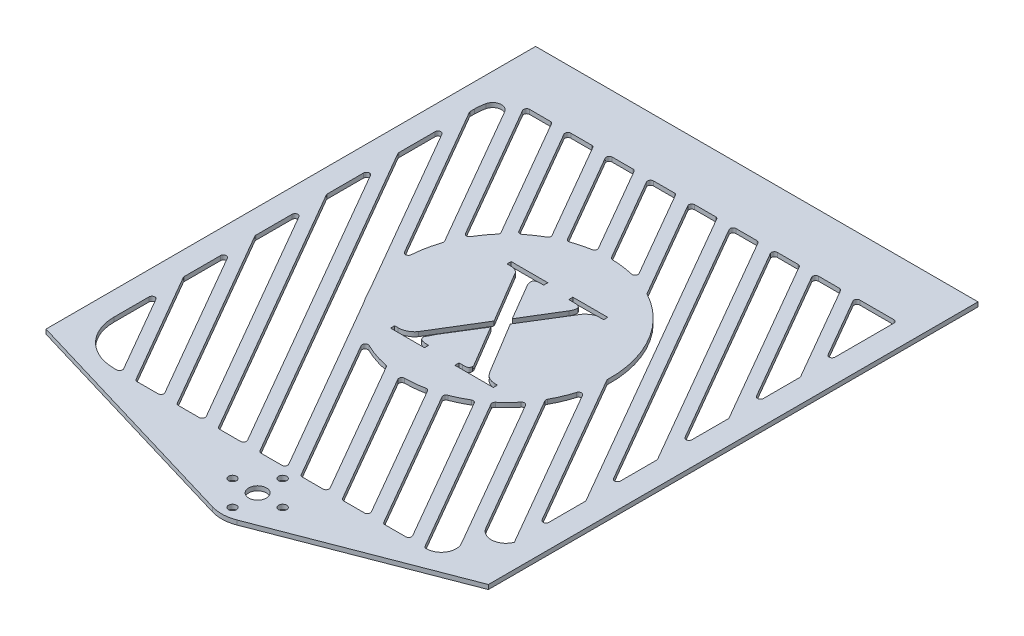
from build123d import *

# Parameters (mm, degrees)
SKETCH_1_R          = 12.25
SKETCH_1_R_2        = 1.35
SKETCH_1_R_3        = 3
EXTRUDE_1_DEPTH     = 1.5
EXTRUDE_START       = -1.5
EXTRUDE_2_DEPTH     = 1.5
CUT_EXTRUDE_2_DEPTH = 188.165201093
CUT_EXTRUDE_3_DEPTH = 10
FILLET_3_R          = 15
FILLET_4_R          = 3
FILLET_5_R          = 5
SKETCH_6_W          = 150
SKETCH_6_H          = 11
EXTRUDE_3_DEPTH     = 1.5
FILLET_6_R          = 1


with BuildPart() as part:
    # 草图1 → 凸台-拉伸1 (new body)
    with BuildSketch(Plane(origin=(0, 0, 0), x_dir=(1, 0, 0), z_dir=(0, 1, 0))):
        with Locations(Location((0, 0, 0), (0, 0, 270))):
            Circle(SKETCH_1_R)
        with Locations(Location((0, 8.5, 0), (0, 0, 270))):
            Circle(SKETCH_1_R_2, mode=Mode.SUBTRACT)
        with Locations(Location((8.5, 0, 0), (0, 0, 270))):
            Circle(SKETCH_1_R_2, mode=Mode.SUBTRACT)
        with Locations(Location((0, -8.5, 0), (0, 0, 270))):
            Circle(SKETCH_1_R_2, mode=Mode.SUBTRACT)
        with Locations(Location((-8.5, 0, 0), (0, 0, 270))):
            Circle(SKETCH_1_R_2, mode=Mode.SUBTRACT)
        with Locations(Location((0, 0, 0), (0, 0, 270))):
            Circle(SKETCH_1_R_3, mode=Mode.SUBTRACT)
    extrude(amount=EXTRUDE_1_DEPTH)

    # 草图2 → 凸台-拉伸2 (add)
    with BuildSketch(Plane(origin=(0, 1.5, 0), x_dir=(1, 0, 0), z_dir=(0, 1, 0)).offset(EXTRUDE_START)):
        with BuildLine():
            Line((-84, 12.25), (-3.498512537, -11.739800255))
            ThreePointArc((-3.498512537, -11.739800255), (-0.474020435, 12.240825325), (4.395911064, -11.434092265))
            Line((4.395911064, -11.434092265), (66, 12.25))
            Line((66, 12.25), (66, 167.25))
            Line((66, 167.25), (-84, 167.25))
            Line((-84, 167.25), (-84, 12.25))
        make_face()
    extrude(amount=EXTRUDE_2_DEPTH)

    # 草图4 → 切除-拉伸2 (cut, through all)
    with BuildSketch(Plane(origin=(0, 1.5, 0), x_dir=(1, 0, 0), z_dir=(0, 1, 0))):
        with BuildLine():
            Line((-6.774095733, 92.456140351), (3.8388564, 74.912280702))
            add(Edge.make_bspline(
                [(3.8388564, 74.912280702), (3.990709067, 74.692636132), (4.2799757, 74.274231591), (4.761505175, 73.718644294), (5.262896761, 73.264665473), (5.789882123, 72.907665947), (6.342654511, 72.661359883), (6.90483624, 72.474337914), (7.487133075, 72.356744918), (7.884234413, 72.345060393), (8.084037254, 72.339181287)],
                knots=[0, 0, 0, 0, 1.231960927, 2.346782558, 3.385184183, 4.346451651, 5.270969098, 6.168867011, 7.078659433, 8, 8, 8, 8], degree=3))
            Line((8.084037254, 72.339181287), (8.993718865, 72.339181287))
            Line((8.993718865, 72.339181287), (8.993718865, 70.935672515))
            Line((8.993718865, 70.935672515), (-4.045050899, 70.935672515))
            Line((-4.045050899, 70.935672515), (-4.045050899, 72.339181287))
            Line((-4.045050899, 72.339181287), (-2.832142084, 72.339181287))
            add(Edge.make_bspline(
                [(-2.832142084, 72.339181287), (-2.603856116, 72.344829862), (-2.198269681, 72.354865456), (-1.662002639, 72.406056705), (-1.271320107, 72.505072734), (-0.949736715, 72.703294184), (-0.758262133, 73.064186857), (-0.725859892, 73.359925143), (-0.709551657, 73.50877193)],
                knots=[0, 0, 0, 0, 1.480939666, 2.631125546, 3.490581069, 4.072498027, 5.029877129, 6, 6, 6, 6], degree=3))
            add(Edge.make_bspline(
                [(-0.709551657, 73.50877193), (-0.725375877, 73.667939704), (-0.758524054, 74.001360346), (-0.925508935, 74.29236112), (-1.012778861, 74.444444444)],
                knots=[0, 0, 0, 0, 0.954756568, 2, 2, 2, 2], degree=3))
            Line((-1.012778861, 74.444444444), (-9.199913364, 88.245614035))
            Line((-9.199913364, 88.245614035), (-16.174139051, 77.01754386))
            add(Edge.make_bspline(
                [(-16.174139051, 77.01754386), (-16.270268942, 76.833140892), (-16.451179764, 76.486105312), (-16.694852575, 75.988387373), (-16.90195827, 75.548980822), (-17.026381927, 75.273411982), (-17.083820663, 75.14619883)],
                knots=[0, 0, 0, 0, 1.199066972, 2.256573778, 3.195167548, 4, 4, 4, 4], degree=3))
            add(Edge.make_bspline(
                [(-17.083820663, 75.14619883), (-17.17718498, 75.006686055), (-17.34187262, 74.760596001), (-17.5101519, 74.414882452), (-17.658456751, 74.178255463), (-17.681466712, 74.032430793), (-17.69027507, 73.976608187)],
                knots=[0, 0, 0, 0, 1.515902277, 2.673937721, 3.492374973, 4, 4, 4, 4], degree=3))
            add(Edge.make_bspline(
                [(-17.69027507, 73.976608187), (-17.68521353, 73.830447657), (-17.67568119, 73.555185258), (-17.517112577, 73.183168295), (-17.27378702, 72.881322575), (-16.931417896, 72.663845089), (-16.515116327, 72.529204475), (-16.049944951, 72.411264663), (-15.522635664, 72.357502805), (-15.154772007, 72.34549754), (-14.961230236, 72.339181287)],
                knots=[0, 0, 0, 0, 0.966903205, 1.820957383, 2.641401959, 3.516652834, 4.478372564, 5.547131829, 6.709488039, 8, 8, 8, 8], degree=3))
            Line((-14.961230236, 72.339181287), (-14.354775828, 72.339181287))
            Line((-14.354775828, 72.339181287), (-14.354775828, 70.935672515))
            Line((-14.354775828, 70.935672515), (-25.877409573, 70.935672515))
            Line((-25.877409573, 70.935672515), (-25.877409573, 72.339181287))
            Line((-25.877409573, 72.339181287), (-24.664500758, 72.339181287))
            add(Edge.make_bspline(
                [(-24.664500758, 72.339181287), (-24.418495397, 72.347385612), (-23.934487, 72.363527383), (-23.224910427, 72.49503351), (-22.556778473, 72.722794414), (-21.933893095, 73.027301415), (-21.367957342, 73.386301289), (-20.872972794, 73.786238391), (-20.44778626, 74.209382937), (-20.224656855, 74.524864333), (-20.116092701, 74.678362573)],
                knots=[0, 0, 0, 0, 1.109548882, 2.18300517, 3.242048789, 4.285260785, 5.30468078, 6.259150818, 7.152985601, 8, 8, 8, 8], degree=3))
            Line((-20.116092701, 74.678362573), (-10.412822179, 90.584795322))
            Line((-10.412822179, 90.584795322), (-20.722547109, 107.894736842))
            add(Edge.make_bspline(
                [(-20.722547109, 107.894736842), (-20.77939181, 108.00964542), (-20.892965203, 108.239228068), (-21.135987472, 108.548201186), (-21.434847425, 108.826914427), (-21.789062971, 109.076891364), (-22.197896668, 109.28807621), (-22.666402554, 109.434438317), (-23.191311946, 109.521154138), (-23.560971971, 109.528376425), (-23.754819147, 109.532163743)],
                knots=[0, 0, 0, 0, 0.84023109, 1.678747421, 2.564428756, 3.517053343, 4.518117347, 5.573937512, 6.727789513, 8, 8, 8, 8], degree=3))
            Line((-23.754819147, 109.532163743), (-24.967727962, 109.532163743))
            Line((-24.967727962, 109.532163743), (-24.967727962, 110.935672515))
            Line((-24.967727962, 110.935672515), (-12.535412606, 110.935672515))
            Line((-12.535412606, 110.935672515), (-12.535412606, 109.532163743))
            Line((-12.535412606, 109.532163743), (-13.445094217, 109.532163743))
            add(Edge.make_bspline(
                [(-13.445094217, 109.532163743), (-13.717300174, 109.525936846), (-14.202180301, 109.514844884), (-14.84307913, 109.395101946), (-15.31684967, 109.184696443), (-15.602281243, 108.837446935), (-15.681965309, 108.409019919), (-15.658969536, 107.915937259), (-15.506826395, 107.343088607), (-15.34984432, 106.942848067), (-15.26445744, 106.725146199)],
                knots=[0, 0, 0, 0, 1.445461397, 2.574798561, 3.453827859, 4.142091928, 4.868361955, 5.713474923, 6.756295948, 8, 8, 8, 8], degree=3))
            Line((-15.26445744, 106.725146199), (-7.987004548, 94.32748538))
            Line((-7.987004548, 94.32748538), (-0.709551657, 106.257309942))
            add(Edge.make_bspline(
                [(-0.709551657, 106.257309942), (-0.575412858, 106.511089371), (-0.332749203, 106.970188784), (-0.096229746, 107.64047753), (0.001295172, 108.214072564), (-0.067445253, 108.710438663), (-0.3350494, 109.122397951), (-0.825432283, 109.360715977), (-1.464912059, 109.513194536), (-1.952805528, 109.525359689), (-2.225687676, 109.532163743)],
                knots=[0, 0, 0, 0, 1.377633241, 2.492205975, 3.402744337, 4.14869509, 4.849118974, 5.663198192, 6.693010792, 8, 8, 8, 8], degree=3))
            Line((-2.225687676, 109.532163743), (-4.045050899, 109.532163743))
            Line((-4.045050899, 109.532163743), (-4.045050899, 110.935672515))
            Line((-4.045050899, 110.935672515), (7.78081005, 110.935672515))
            Line((7.78081005, 110.935672515), (7.78081005, 109.532163743))
            Line((7.78081005, 109.532163743), (5.961446827, 109.532163743))
            add(Edge.make_bspline(
                [(5.961446827, 109.532163743), (5.8541413, 109.526861819), (5.622034091, 109.515393495), (5.258431809, 109.42091553), (4.85857371, 109.271656102), (4.263576117, 108.981508671), (3.470656657, 108.485619502), (2.919286068, 107.947243732), (2.625947585, 107.660818713)],
                knots=[0, 0, 0, 0, 0.493908267, 1.068348223, 1.720846286, 2.458775751, 4.116008779, 6, 6, 6, 6], degree=3))
            Line((2.625947585, 107.660818713), (-6.774095733, 92.456140351))
        make_face()
    extrude(amount=-CUT_EXTRUDE_2_DEPTH, mode=Mode.SUBTRACT)

    # 草图5 → 切除-拉伸3 (cut)
    with BuildSketch(Plane(origin=(0, 1.5, 0), x_dir=(1, 0, 0), z_dir=(0, 1, 0))):
        Polygon((-76, 42.891016151), (-76, 12.25), (-58.309401077, 12.25), align=None)
        Polygon((-76, 50.891016151), (-53.690598923, 12.25), (-44.309401077, 12.25), (-76, 67.139727457), align=None)
        Polygon((-76, 75.139727457), (-39.690598923, 12.25), (-30.309401077, 12.25), (-76, 91.388438763), align=None)
        Polygon((-76, 99.388438763), (-25.690598923, 12.25), (-16.309401077, 12.25), (-76, 115.637150069), align=None)
        with BuildLine():
            Line((-11.690598923, 12.25), (-2.309401077, 12.25))
            Line((-2.309401077, 12.25), (-37.855859073, 73.818271279))
            ThreePointArc((-37.855859073, 73.818271279), (-39.310889132, 76.12583037), (-40.581778896, 78.53970291))
            Line((-40.581778896, 78.53970291), (-76, 139.885861375))
            Line((-76, 139.885861375), (-76, 123.637150069))
            Line((-76, 123.637150069), (-11.690598923, 12.25))
        make_face()
        with BuildLine():
            Line((2.309401077, 12.25), (11.690598923, 12.25))
            Line((11.690598923, 12.25), (-15.428243654, 59.221213187))
            ThreePointArc((-15.428243654, 59.221213187), (-21.699626365, 61.011117583), (-27.530057327, 63.933458025))
            Line((-27.530057327, 63.933458025), (2.309401077, 12.25))
        make_face()
        with BuildLine():
            Line((16.309401077, 12.25), (25.690598923, 12.25))
            Line((25.690598923, 12.25), (-1.547852441, 59.428381682))
            ThreePointArc((-1.547852441, 59.428381682), (-5.991056913, 58.755409359), (-10.483865857, 58.65729963))
            Line((-10.483865857, 58.65729963), (16.309401077, 12.25))
        make_face()
        with BuildLine():
            Line((-76, 147.885861375), (-43.979377413, 92.424516164))
            ThreePointArc((-43.979377413, 92.424516164), (-43.594982993, 98.934987713), (-42.009394315, 105.261116655))
            Line((-42.009394315, 105.261116655), (-72.891215513, 158.75))
            Line((-72.891215513, 158.75), (-76, 158.75))
            Line((-76, 158.75), (-76, 147.885861375))
        make_face()
        with BuildLine():
            Line((-34.889785529, 117.178303813), (-58.891215513, 158.75))
            Line((-58.891215513, 158.75), (-68.27241336, 158.75))
            Line((-68.27241336, 158.75), (-40.025568882, 109.825030212))
            ThreePointArc((-40.025568882, 109.825030212), (-37.694198893, 113.666862028), (-34.889785529, 117.178303813))
        make_face()
        with BuildLine():
            Line((-25.203179379, 124.649321115), (-44.891215513, 158.75))
            Line((-44.891215513, 158.75), (-54.27241336, 158.75))
            Line((-54.27241336, 158.75), (-31.936424968, 120.062933269))
            ThreePointArc((-31.936424968, 120.062933269), (-28.703702583, 122.552705495), (-25.203179379, 124.649321115))
        make_face()
        with BuildLine():
            Line((-13.342856671, 128.355350896), (-30.891215513, 158.75))
            Line((-30.891215513, 158.75), (-40.27241336, 158.75))
            Line((-40.27241336, 158.75), (-21.538932642, 126.302659595))
            ThreePointArc((-21.538932642, 126.302659595), (-17.503063448, 127.577235525), (-13.342856671, 128.355350896))
        make_face()
        with BuildLine():
            Line((1.416682535, 127.039790401), (-16.891215513, 158.75))
            Line((-16.891215513, 158.75), (-26.27241336, 158.75))
            Line((-26.27241336, 158.75), (-8.880097338, 128.625624989))
            ThreePointArc((-8.880097338, 128.625624989), (-3.672371565, 128.217973629), (1.416682535, 127.039790401))
        make_face()
        with BuildLine():
            Line((25.981631517, 92.492050678), (58, 37.034609691))
            Line((58, 37.034609691), (58, 53.283320997))
            Line((58, 53.283320997), (-2.891215513, 158.75))
            Line((-2.891215513, 158.75), (-12.27241336, 158.75))
            Line((-12.27241336, 158.75), (7.508933743, 124.487701776))
            ThreePointArc((7.508933743, 124.487701776), (21.023429859, 111.614539593), (26, 93.62583037))
            ThreePointArc((26, 93.62583037), (25.995407578, 93.058866132), (25.981631517, 92.492050678))
        make_face()
        with BuildLine():
            Line((21.370662598, 76.229771812), (58, 12.785898385))
            Line((58, 12.785898385), (58, 29.034609691))
            Line((58, 29.034609691), (25.145679495, 85.939962053))
            ThreePointArc((25.145679495, 85.939962053), (23.621489051, 80.943620307), (21.370662598, 76.229771812))
        make_face()
        with BuildLine():
            Line((44.309401077, 12.25), (53.690598923, 12.25))
            Line((53.690598923, 12.25), (18.905218701, 72.500045905))
            ThreePointArc((18.905218701, 72.500045905), (16.151247635, 69.286258837), (13.029497903, 66.428381553))
            Line((13.029497903, 66.428381553), (44.309401077, 12.25))
        make_face()
        with BuildLine():
            Line((30.309401077, 12.25), (39.690598923, 12.25))
            Line((39.690598923, 12.25), (9.76554141, 64.081720033))
            ThreePointArc((9.76554141, 64.081720033), (6.199557419, 62.098485822), (2.426990229, 60.543752226))
            Line((2.426990229, 60.543752226), (30.309401077, 12.25))
        make_face()
        Polygon((1.72758664, 158.75), (58, 61.283320997), (58, 77.532032303), (11.108784487, 158.75), align=None)
        Polygon((15.72758664, 158.75), (58, 85.532032303), (58, 101.780743609), (25.108784487, 158.75), align=None)
        Polygon((29.72758664, 158.75), (58, 109.780743609), (58, 126.029454915), (39.108784487, 158.75), align=None)
        Polygon((43.72758664, 158.75), (58, 134.029454915), (58, 158.75), align=None)
    extrude(amount=-CUT_EXTRUDE_3_DEPTH, mode=Mode.SUBTRACT)

    # 圆角3
    # the kernel refuses this fillet: 15 mm, written as the material it adds along each edge
    with BuildSketch(Plane(origin=(-76, 1.5, -158.75), x_dir=(1, 0, 0), z_dir=(0, -1, 0))) as fillet_3_piece_1:
        with BuildLine():
            CenterArc((15, 9.143248527), FILLET_3_R, 180, 37.556965045)
            Line((0, 9.143248527), (-0.3, 9.143248527))
            Line((-0.3, 9.143248527), (-0.3, 0))
            Line((-0.3, 0), (0, -0.3))
            ThreePointArc((0, -0.3), (1.554392243, -0.3), (2.870960177, -0.182864971))
            Line((2.870960177, -0.182864971), (3.108784487, 0))
        make_face()
    extrude(amount=1.5)
    with BuildSketch(Plane(origin=(-76, 1.5, -12.25), x_dir=(0, 0, -1), z_dir=(0, -1, 0))) as fillet_3_piece_2:
        with BuildLine():
            CenterArc((FILLET_3_R, FILLET_3_R), FILLET_3_R, 180, 90)
            Line((0, FILLET_3_R), (-FILLET_3_R * 0.02, FILLET_3_R))
            Line((-FILLET_3_R * 0.02, FILLET_3_R), (-FILLET_3_R * 0.02, -FILLET_3_R * 0.02))
            Line((-FILLET_3_R * 0.02, -FILLET_3_R * 0.02), (FILLET_3_R, -FILLET_3_R * 0.02))
            Line((FILLET_3_R, -FILLET_3_R * 0.02), (FILLET_3_R, 0))
        make_face()
    extrude(amount=1.5)

    # 圆角4
    fillet_4_edges = [part.edges().sort_by_distance(p)[0] for p in [
        (-72.891215513, 0.75, -158.75),
    ]]
    fillet(fillet_4_edges, radius=FILLET_4_R)

    # 圆角5
    # the kernel refuses this fillet: 5 mm, written as the material it adds along each edge
    with BuildSketch(Plane(origin=(53.690598923, 1.5, -12.25), x_dir=(-0.4999999999999996, 0, -0.8660254037844388), z_dir=(0, -1, 0))) as fillet_5_piece_1:
        with BuildLine():
            CenterArc((FILLET_5_R * 1.73205080757, -FILLET_5_R), FILLET_5_R, 90, 120)
            Line((FILLET_5_R * 0.866025403784, -FILLET_5_R * 1.5), (FILLET_5_R * 0.848704895709, -FILLET_5_R * 1.51))
            Line((FILLET_5_R * 0.848704895709, -FILLET_5_R * 1.51), (-FILLET_5_R * 0.0173205080757, -FILLET_5_R * 0.01))
            Line((-FILLET_5_R * 0.0173205080757, -FILLET_5_R * 0.01), (0, FILLET_5_R * 0.02))
            Line((0, FILLET_5_R * 0.02), (FILLET_5_R * 1.73205080757, FILLET_5_R * 0.02))
            Line((FILLET_5_R * 1.73205080757, FILLET_5_R * 0.02), (FILLET_5_R * 1.73205080757, 0))
        make_face()
    extrude(amount=1.5)
    with BuildSketch(Plane(origin=(58, 1.5, -12.785898385), x_dir=(-0.5000000000000001, 0, -0.8660254037844385), z_dir=(0, -1, 0))) as fillet_5_piece_2:
        with BuildLine():
            CenterArc((17.975436322, 5), FILLET_5_R, 141.327270593, 128.672729407)
            Line((14.07179677, 8.124355653), (13.993723979, 8.186842766))
            ThreePointArc((13.993723979, 8.186842766), (6.985898385, 4.148780367), (-0.05, 0.08660254))
            Line((-0.05, 0.08660254), (0, -0.1))
            Line((0, -0.1), (17.975436322, -0.1))
            Line((17.975436322, -0.1), (17.975436322, 0))
        make_face()
    extrude(amount=1.5)

    # 草图6 → 凸台-拉伸3 (add)
    with BuildSketch(Plane(origin=(0, 1.5, 0), x_dir=(1, 0, 0), z_dir=(0, 1, 0))):
        with Locations((-9, 172.75)):
            Rectangle(SKETCH_6_W, SKETCH_6_H)
    extrude(amount=-EXTRUDE_3_DEPTH)

    # 圆角6
    fillet_6_edges = [part.edges().sort_by_distance(p)[0] for p in [
        (1.416682535, 0.75, -127.039790401),
        (-8.880097338, 0.75, -128.625624989),
        (-26.27241336, 0.75, -158.75),
        (-16.891215513, 0.75, -158.75),
        (25.981631517, 0.75, -92.492050678),
        (7.508933743, 0.75, -124.487701776),
        (-12.27241336, 0.75, -158.75),
        (-2.891215513, 0.75, -158.75),
        (58, 0.75, -53.283320997),
        (58, 0.75, -37.034609691),
        (-25.203179379, 0.75, -124.649321115),
        (-31.936424968, 0.75, -120.062933269),
        (-54.27241336, 0.75, -158.75),
        (-44.891215513, 0.75, -158.75),
        (-13.342856671, 0.75, -128.355350896),
        (-21.538932642, 0.75, -126.302659595),
        (-40.27241336, 0.75, -158.75),
        (-30.891215513, 0.75, -158.75),
        (2.426990229, 0.75, -60.543752226),
        (9.76554141, 0.75, -64.081720033),
        (39.690598923, 0.75, -12.25),
        (30.309401077, 0.75, -12.25),
        (58, 0.75, -77.532032303),
        (58, 0.75, -61.283320997),
        (1.72758664, 0.75, -158.75),
        (11.108784487, 0.75, -158.75),
        (21.370662598, 0.75, -76.229771812),
        (25.145679495, 0.75, -85.939962053),
        (13.029497903, 0.75, -66.428381553),
        (18.905218701, 0.75, -72.500045905),
        (44.309401077, 0.75, -12.25),
        (-16.309401077, 0.75, -12.25),
        (-25.690598923, 0.75, -12.25),
        (-76, 0.75, -99.388438763),
        (-76, 0.75, -115.637150069),
        (-40.581778896, 0.75, -78.53970291),
        (-37.855859073, 0.75, -73.818271279),
        (-2.309401077, 0.75, -12.25),
        (-11.690598923, 0.75, -12.25),
        (-76, 0.75, -123.637150069),
        (-76, 0.75, -139.885861375),
        (-44.309401077, 0.75, -12.25),
        (-53.690598923, 0.75, -12.25),
        (-76, 0.75, -50.891016151),
        (-76, 0.75, -67.139727457),
        (-30.309401077, 0.75, -12.25),
        (-39.690598923, 0.75, -12.25),
        (-76, 0.75, -75.139727457),
        (-76, 0.75, -91.388438763),
        (-10.483865857, 0.75, -58.65729963),
        (-1.547852441, 0.75, -59.428381682),
        (25.690598923, 0.75, -12.25),
        (16.309401077, 0.75, -12.25),
        (-27.530057327, 0.75, -63.933458025),
        (-15.428243654, 0.75, -59.221213187),
        (11.690598923, 0.75, -12.25),
        (2.309401077, 0.75, -12.25),
        (-34.889785529, 0.75, -117.178303813),
        (-40.025568882, 0.75, -109.825030212),
        (-68.27241336, 0.75, -158.75),
        (-58.891215513, 0.75, -158.75),
        (-42.009394315, 0.75, -105.261116655),
        (-43.979377413, 0.75, -92.424516164),
        (-76, 0.75, -147.885861375),
        (58, 0.75, -134.029454915),
        (43.72758664, 0.75, -158.75),
        (58, 0.75, -158.75),
        (58, 0.75, -101.780743609),
        (58, 0.75, -85.532032303),
        (15.72758664, 0.75, -158.75),
        (25.108784487, 0.75, -158.75),
        (58, 0.75, -126.029454915),
        (58, 0.75, -109.780743609),
        (29.72758664, 0.75, -158.75),
        (39.108784487, 0.75, -158.75),
        (-58.309401077, 0.75, -12.25),
        (-76, 0.75, -42.891016151),
    ]]
    fillet(fillet_6_edges, radius=FILLET_6_R)


solid = part.part
